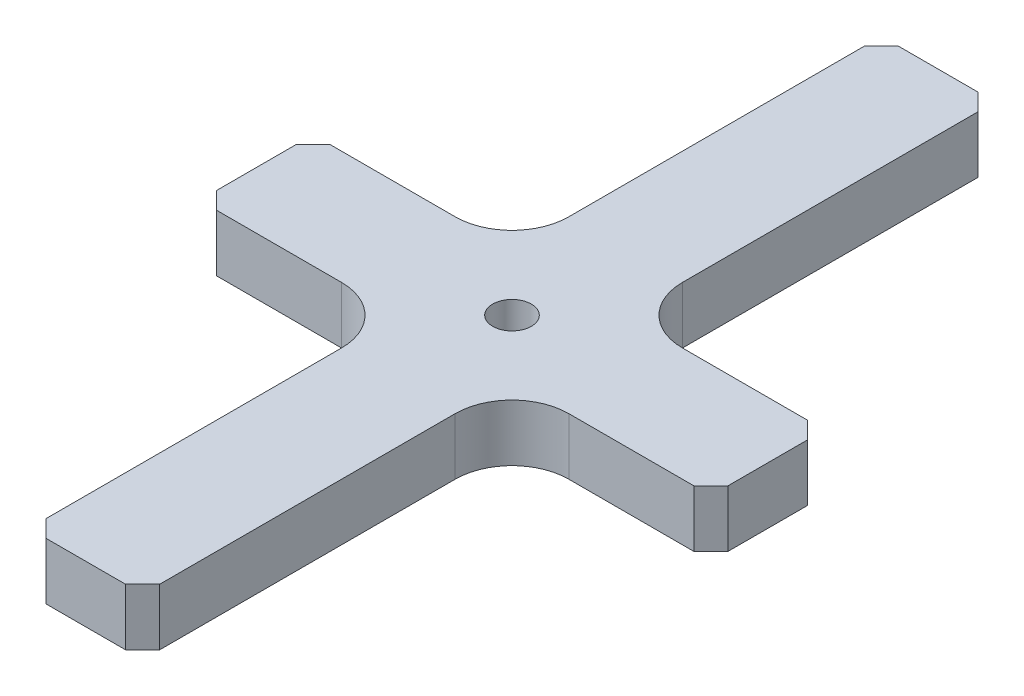
from build123d import *

# Parameters (mm, degrees)
BOSS_EXTRUDE1_DEPTH      = 2.5
FILLET1_R                = 5
CHAMFER1_SIZE            = 1.5
M3_CLEARANCE_HOLE1_D     = 3.4
M3_CLEARANCE_HOLE1_DEPTH = 5.2
M3_CLEARANCE_HOLE1_TIP   = 1.021463052


with BuildPart() as part:
    # Sketch2 → Boss-Extrude1 (new, symmetric)
    with BuildSketch(Plane(origin=(0, 0, 0), x_dir=(1, 0, 0), z_dir=(0, 1, 0))):
        Polygon((-5, 37.5), (5, 37.5), (5, 5), (22.5, 5), (22.5, -5), (5, -5), (5, -37.5), (-5, -37.5), (-5, -5), (-22.5, -5), (-22.5, 5), (-5, 5), align=None)
    extrude(amount=BOSS_EXTRUDE1_DEPTH, both=True)

    # Fillet1
    fillet1_edges = [part.edges().sort_by_distance(p)[0] for p in [
        (-5, 0, -5),
        (5, 0, -5),
        (5, 0, 5),
        (-5, 0, 5),
    ]]
    fillet(fillet1_edges, radius=FILLET1_R)

    # Chamfer1
    chamfer1_edges = [part.edges().sort_by_distance(p)[0] for p in [
        (-22.5, 0, 5),
        (-22.5, 0, -5),
        (-5, 0, -37.5),
        (5, 0, -37.5),
        (22.5, 0, -5),
        (22.5, 0, 5),
        (5, 0, 37.5),
        (-5, 0, 37.5),
    ]]
    chamfer(chamfer1_edges, length=CHAMFER1_SIZE)

    # M3 Clearance Hole1
    with Locations(Plane(origin=(0, 2.5, 0), x_dir=(1, 0, 0), z_dir=(0, 1, 0))):
        with Locations((0, 0)):
            Hole(M3_CLEARANCE_HOLE1_D / 2, depth=M3_CLEARANCE_HOLE1_DEPTH)
            with Locations((0, 0, -(M3_CLEARANCE_HOLE1_DEPTH + M3_CLEARANCE_HOLE1_TIP / 2))):  # 118° drill point
                Cone(0, M3_CLEARANCE_HOLE1_D / 2, M3_CLEARANCE_HOLE1_TIP, mode=Mode.SUBTRACT)


solid = part.part
